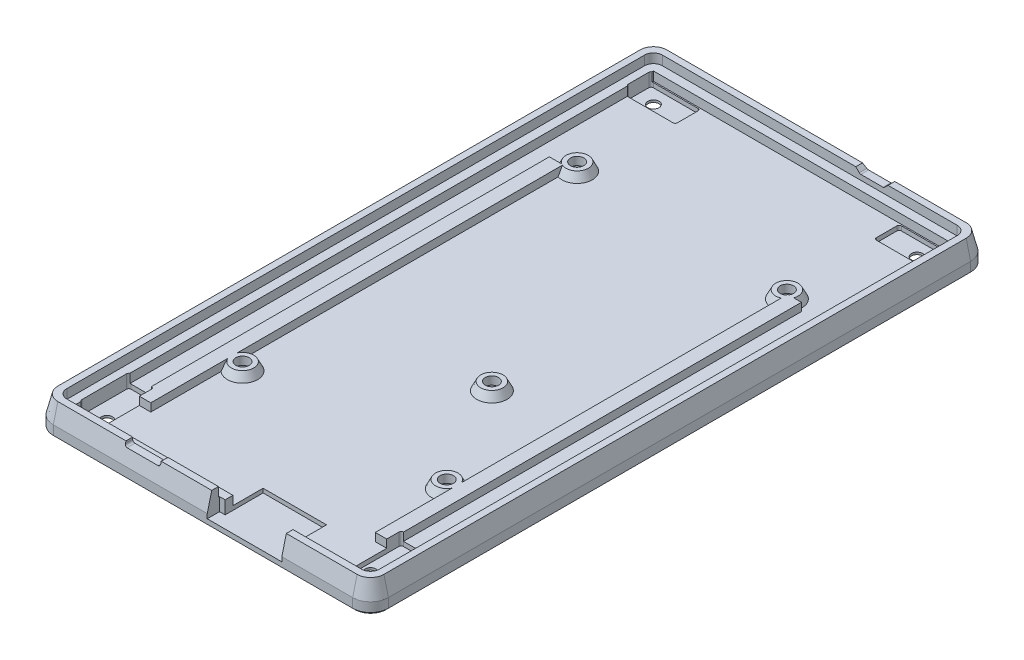
from build123d import *

# Parameters (mm, degrees)
SKETCH3_W                       = 66
SKETCH3_H                       = 129.34
EXTRUDE_THIN3_DEPTH             = 4.08
BOSS_EXTRUDE2_START             = -2.5
BOSS_EXTRUDE2_DEPTH             = 2.5
CUT_EXTRUDE1_DEPTH              = 2.08
SKETCH10_5_R                    = 1.5
SKETCH10_5_R_2                  = 4
BOSS_EXTRUDE3_DEPTH             = 1.8
SKETCH23_W                      = 16.7
SKETCH23_H                      = 2.5
SKETCH23_H_2                    = 0.35
CUT_EXTRUDE3_DEPTH              = 5
CUT_EXTRUDE18_START             = -2.5
CUT_EXTRUDE18_DEPTH             = 2.5
CUT_EXTRUDE20_REACH             = 142.993
CUT_EXTRUDE20_DIRECTION_2_REACH = 142.993
SKETCH26_R                      = 3.5
SKETCH26_R_2                    = 1.25
CUT_EXTRUDE6_DEPTH              = 1
CUT_EXTRUDE7_DEPTH              = 2.5
SKETCH10_7_W                    = 3.08
SKETCH10_7_H                    = 92.3
BOSS_EXTRUDE5_DEPTH             = 1.8
CUT_EXTRUDE9_START              = -3
CUT_EXTRUDE9_DEPTH              = 5.08
CUT_EXTRUDE19_DEPTH             = 79.955907315
CUT_EXTRUDE19_DEPTH_BACK        = 79.955907315
SKETCH26_3_R                    = 1.25
CHAMFER4_SIZE                   = 0.5
CHAMFER5_SIZE                   = 1
CHAMFER5_SIZE_2                 = 4


with BuildPart() as part:
    # Sketch3 → Extrude-Thin3 (new body)
    with BuildSketch(Plane(origin=(0, -2, 0), x_dir=(1, 0, 0), z_dir=(0, 1, 0))):
        with BuildLine():
            Line((33.5, 69.17), (-33.5, 69.17))
            ThreePointArc((-33.5, 69.17), (-36.328427125, 67.998427125), (-37.5, 65.17))
            Line((-37.5, 65.17), (-37.5, -65.17))
            ThreePointArc((-37.5, -65.17), (-36.328427125, -67.998427125), (-33.5, -69.17))
            Line((-33.5, -69.17), (33.5, -69.17))
            ThreePointArc((33.5, -69.17), (36.328427125, -67.998427125), (37.5, -65.17))
            Line((37.5, -65.17), (37.5, 65.17))
            ThreePointArc((37.5, 65.17), (36.328427125, 67.998427125), (33.5, 69.17))
        make_face()
        Rectangle(SKETCH3_W, SKETCH3_H, mode=Mode.SUBTRACT)
    extrude(amount=EXTRUDE_THIN3_DEPTH)

    # Sketch10 → Boss-Extrude2 (add)
    with BuildSketch(Plane(origin=(0, -2, 0), x_dir=(1, 0, 0), z_dir=(0, 1, 0)).offset(BOSS_EXTRUDE2_START)):
        with BuildLine():
            ThreePointArc((-37.5, -65.17), (-36.328427125, -67.998427125), (-33.5, -69.17))
            Line((-33.5, -69.17), (33.5, -69.17))
            ThreePointArc((33.5, -69.17), (36.328427125, -67.998427125), (37.5, -65.17))
            Line((37.5, -65.17), (37.5, 65.17))
            ThreePointArc((37.5, 65.17), (36.328427125, 67.998427125), (33.5, 69.17))
            Line((33.5, 69.17), (-33.5, 69.17))
            ThreePointArc((-33.5, 69.17), (-36.328427125, 67.998427125), (-37.5, 65.17))
            Line((-37.5, 65.17), (-37.5, -65.17))
        make_face()
    extrude(amount=BOSS_EXTRUDE2_DEPTH)

    # Sketch1 → Cut-Extrude1 (cut)
    with BuildSketch(Plane(origin=(0, 0, 0), x_dir=(1, 0, 0), z_dir=(0, 1, 0))):
        with BuildLine():
            Line((-33, 66.67), (33, 66.67))
            ThreePointArc((33, 66.67), (34.414213562, 66.084213562), (35, 64.67))
            Line((35, 64.67), (35, -64.67))
            ThreePointArc((35, -64.67), (34.414213562, -66.084213562), (33, -66.67))
            Line((33, -66.67), (-33, -66.67))
            ThreePointArc((-33, -66.67), (-34.414213562, -66.084213562), (-35, -64.67))
            Line((-35, -64.67), (-35, 64.67))
            ThreePointArc((-35, 64.67), (-34.414213562, 66.084213562), (-33, 66.67))
        make_face()
        with BuildLine():
            Line((-32.77, 64.39), (-22.77, 64.39))
            ThreePointArc((-22.77, 64.39), (-22.416446609, 64.243553391), (-22.27, 63.89))
            Line((-22.27, 63.89), (-22.27, 59.31))
            ThreePointArc((-22.27, 59.31), (-22.416446609, 58.956446609), (-22.77, 58.81))
            Line((-22.77, 58.81), (-32.77, 58.81))
            ThreePointArc((-32.77, 58.81), (-33.123553391, 58.956446609), (-33.27, 59.31))
            Line((-33.27, 59.31), (-33.27, 63.89))
            ThreePointArc((-33.27, 63.89), (-33.123553391, 64.243553391), (-32.77, 64.39))
        make_face(mode=Mode.SUBTRACT)
        with BuildLine():
            Line((-32.77, -52.51), (-28.19, -52.51))
            ThreePointArc((-28.19, -52.51), (-27.836446609, -52.656446609), (-27.69, -53.01))
            Line((-27.69, -53.01), (-27.69, -63.01))
            ThreePointArc((-27.69, -63.01), (-27.836446609, -63.363553391), (-28.19, -63.51))
            Line((-28.19, -63.51), (-32.77, -63.51))
            ThreePointArc((-32.77, -63.51), (-33.123553391, -63.363553391), (-33.27, -63.01))
            Line((-33.27, -63.01), (-33.27, -53.01))
            ThreePointArc((-33.27, -53.01), (-33.123553391, -52.656446609), (-32.77, -52.51))
        make_face(mode=Mode.SUBTRACT)
        with BuildLine():
            Line((33.27, -53.01), (33.27, -63.01))
            ThreePointArc((33.27, -63.01), (33.123553391, -63.363553391), (32.77, -63.51))
            Line((32.77, -63.51), (28.19, -63.51))
            ThreePointArc((28.19, -63.51), (27.836446609, -63.363553391), (27.69, -63.01))
            Line((27.69, -63.01), (27.69, -53.01))
            ThreePointArc((27.69, -53.01), (27.836446609, -52.656446609), (28.19, -52.51))
            Line((28.19, -52.51), (32.77, -52.51))
            ThreePointArc((32.77, -52.51), (33.123553391, -52.656446609), (33.27, -53.01))
        make_face(mode=Mode.SUBTRACT)
        with BuildLine():
            Line((32.77, 58.81), (22.77, 58.81))
            ThreePointArc((22.77, 58.81), (22.416446609, 58.956446609), (22.27, 59.31))
            Line((22.27, 59.31), (22.27, 63.89))
            ThreePointArc((22.27, 63.89), (22.416446609, 64.243553391), (22.77, 64.39))
            Line((22.77, 64.39), (32.77, 64.39))
            ThreePointArc((32.77, 64.39), (33.123553391, 64.243553391), (33.27, 63.89))
            Line((33.27, 63.89), (33.27, 59.31))
            ThreePointArc((33.27, 59.31), (33.123553391, 58.956446609), (32.77, 58.81))
        make_face(mode=Mode.SUBTRACT)
    extrude(amount=CUT_EXTRUDE1_DEPTH, mode=Mode.SUBTRACT)

    # Sketch10<5> → Boss-Extrude3 (add)
    # profile 1 of 5: a face of its own
    with BuildSketch(Plane(origin=(0, -2, 0), x_dir=(1, 0, 0), z_dir=(0, 1, 0))):
        with BuildLine():
            ThreePointArc((-25.13, 34.837016654), (-21.775087701, 41.943324615), (-27.509408232, 36.57))
            Line((-27.509408232, 36.57), (-25.13, 36.57))
            Line((-25.13, 36.57), (-25.13, 34.837016654))
        make_face()
        with Locations(Location((-24.13, 38.71, 0), (0, 0, 90))):
            Circle(SKETCH10_5_R, mode=Mode.SUBTRACT)
    # profile 2 of 5: a face of its own
    with BuildSketch(Plane(origin=(0, -2, 0), x_dir=(1, 0, 0), z_dir=(0, 1, 0))):
        with BuildLine():
            ThreePointArc((-25.13, -40.753493586), (-18.86, -37.46), (-25.13, -34.166506414))
            Line((-25.13, -34.166506414), (-25.13, -40.753493586))
        make_face()
        with Locations(Location((-22.86, -37.46, 0), (0, 0, 90))):
            Circle(SKETCH10_5_R, mode=Mode.SUBTRACT)
    # profile 3 of 5: a face of its own
    with BuildSketch(Plane(origin=(0, -2, 0), x_dir=(1, 0, 0), z_dir=(0, 1, 0))):
        with Locations(Location((24.13, 37.41, 0), (0, 0, 90))):
            Circle(SKETCH10_5_R_2)
        with Locations(Location((24.13, 37.41, 0), (0, 0, 90))):
            Circle(SKETCH10_5_R, mode=Mode.SUBTRACT)
    # profile 4 of 5: a face of its own
    with BuildSketch(Plane(origin=(0, -2, 0), x_dir=(1, 0, 0), z_dir=(0, 1, 0))):
        with Locations(Location((8.89, -13.39, 0), (0, 0, 90))):
            Circle(SKETCH10_5_R_2)
        with Locations(Location((8.89, -13.39, 0), (0, 0, 90))):
            Circle(SKETCH10_5_R, mode=Mode.SUBTRACT)
    # profile 5 of 5: a face of its own
    with BuildSketch(Plane(origin=(0, -2, 0), x_dir=(1, 0, 0), z_dir=(0, 1, 0))):
        with Locations(Location((22.86, -37.46, 0), (0, 0, 90))):
            Circle(SKETCH10_5_R_2)
        with Locations(Location((22.86, -37.46, 0), (0, 0, 90))):
            Circle(SKETCH10_5_R, mode=Mode.SUBTRACT)
    extrude(amount=BOSS_EXTRUDE3_DEPTH)

    # Chamfer3: read off the stored shape, not the designer's step
    # Chamfer3 outline → Chamfer3 (revolve, cut)
    with BuildSketch(Plane(origin=(8.89, 0, 13.39), x_dir=(1, 0, 0), z_dir=(0, 0, 1))):
        Polygon((2.5, -0.2), (3.4, -2), (4, -2), (4, -0.2), align=None)
    revolve(axis=Axis((8.89, 0, 13.39), (0, 1, 0)), mode=Mode.SUBTRACT)

    # Chamfer3 2 outline → Chamfer3 2 (revolve, cut)
    with BuildSketch(Plane(origin=(22.86, 0, 37.46), x_dir=(1, 0, 0), z_dir=(0, 0, 1))):
        Polygon((2.5, -0.2), (3.4, -2), (4, -2), (4, -0.2), align=None)
    revolve(axis=Axis((22.86, 0, 37.46), (0, 1, 0)), mode=Mode.SUBTRACT)

    # Chamfer3 3 outline → Chamfer3 3 (revolve, cut)
    with BuildSketch(Plane(origin=(-22.86, 0, 37.46), x_dir=(1, 0, 0), z_dir=(0, 0, 1))):
        Polygon((2.5, -0.2), (3.4, -2), (4, -2), (4, -0.2), align=None)
    revolve(axis=Axis((-22.86, 0, 37.46), (0, 1, 0)), mode=Mode.SUBTRACT)

    # Chamfer3 4 outline → Chamfer3 4 (revolve, cut)
    with BuildSketch(Plane(origin=(24.13, 0, -37.41), x_dir=(1, 0, 0), z_dir=(0, 0, 1))):
        Polygon((2.5, -0.2), (3.4, -2), (4, -2), (4, -0.2), align=None)
    revolve(axis=Axis((24.13, 0, -37.41), (0, 1, 0)), mode=Mode.SUBTRACT)

    # Chamfer3 5 outline → Chamfer3 5 (revolve, cut)
    with BuildSketch(Plane(origin=(-24.13, 0, -38.71), x_dir=(1, 0, 0), z_dir=(0, 0, 1))):
        Polygon((2.5, -0.2), (3.4, -2), (4, -2), (4, -0.2), align=None)
    revolve(axis=Axis((-24.13, 0, -38.71), (0, 1, 0)), mode=Mode.SUBTRACT)

    # Sketch23 → Cut-Extrude3 (cut)
    with BuildSketch(Plane(origin=(0, 2.08, 0), x_dir=(1, 0, 0), z_dir=(0, 1, 0))):
        Polygon((2.2, -66.42), (0.95, -66.42), (0.95, -66.67), (17.65, -66.67), (17.65, -66.42), (16.4, -66.42), (16.4, -57.92), (2.2, -57.92), align=None)
        with Locations((9.3, -67.92)):
            Rectangle(SKETCH23_W, SKETCH23_H)
        with Locations((9.3, -69.345)):
            Rectangle(SKETCH23_W, SKETCH23_H_2)
    extrude(amount=-CUT_EXTRUDE3_DEPTH, mode=Mode.SUBTRACT)

    # Cut-Extrude18: read off the stored shape, not the designer's step
    # Cut-Extrude18 outline → Cut-Extrude18 (cut)
    with BuildSketch(Plane(origin=(0, 0, 66.67), x_dir=(-1, 0, 0), z_dir=(0, 0, -1)).offset(CUT_EXTRUDE18_START)):
        with BuildLine():
            Line((10.35, 2.08), (10.35, 1.620192379))
            ThreePointArc((10.35, 1.620192379), (10.496446609, 1.266638988), (10.85, 1.120192379))
            Line((10.85, 1.120192379), (17.75, 1.120192379))
            ThreePointArc((17.75, 1.120192379), (18.103553391, 1.266638988), (18.25, 1.620192379))
            Line((18.25, 1.620192379), (18.25, 2.08))
            Line((18.25, 2.08), (10.35, 2.08))
        make_face()
    extrude(amount=CUT_EXTRUDE18_DEPTH, mode=Mode.SUBTRACT)

    # Cut-Extrude20: up to this face of the body (flat: up to its plane)
    cut_extrude20_end = Plane(part.part.faces().sort_by_distance((0, -1.21, -69.17))[0])
    # Sketch35 → Cut-Extrude20 (cut, up to the picked face)
    with BuildSketch(Plane.XY.offset(-66.67), mode=Mode.PRIVATE) as cut_extrude20_sk1:
        with BuildLine():
            Line((10.292893219, 2.08), (11.071446609, 1.301446609))
            ThreePointArc((11.071446609, 1.301446609), (11.233658284, 1.193060234), (11.425, 1.155))
            Line((11.425, 1.155), (16.375, 1.155))
            ThreePointArc((16.375, 1.155), (16.566341716, 1.193060234), (16.728553391, 1.301446609))
            Line((16.728553391, 1.301446609), (17.507106781, 2.08))
            Line((17.507106781, 2.08), (10.292893219, 2.08))
        make_face()
    cut_extrude20_tool1 = split(extrude(cut_extrude20_sk1.sketch, amount=-CUT_EXTRUDE20_REACH, mode=Mode.PRIVATE), bisect_by=cut_extrude20_end, keep=Keep.BOTH, mode=Mode.PRIVATE)
    add(cut_extrude20_tool1.solids().sort_by(Axis((13.9, 1.641017, -66.67), (0, 0, -1)))[0], mode=Mode.SUBTRACT)

    # Cut-Extrude20 direction 2: up to this face of the body (flat: up to its plane)
    cut_extrude20_direction_2_end = Plane(part.part.faces().sort_by_distance((0, -1, -64.67))[0])
    # Sketch35 → Cut-Extrude20 direction 2 (cut, up to the picked face)
    with BuildSketch(Plane.XY.offset(-66.67), mode=Mode.PRIVATE) as cut_extrude20_direction_2_sk1:
        with BuildLine():
            Line((10.292893219, 2.08), (11.071446609, 1.301446609))
            ThreePointArc((11.071446609, 1.301446609), (11.233658284, 1.193060234), (11.425, 1.155))
            Line((11.425, 1.155), (16.375, 1.155))
            ThreePointArc((16.375, 1.155), (16.566341716, 1.193060234), (16.728553391, 1.301446609))
            Line((16.728553391, 1.301446609), (17.507106781, 2.08))
            Line((17.507106781, 2.08), (10.292893219, 2.08))
        make_face()
    cut_extrude20_direction_2_tool1 = split(extrude(cut_extrude20_direction_2_sk1.sketch, amount=CUT_EXTRUDE20_DIRECTION_2_REACH, mode=Mode.PRIVATE), bisect_by=cut_extrude20_direction_2_end, keep=Keep.BOTH, mode=Mode.PRIVATE)
    add(cut_extrude20_direction_2_tool1.solids().sort_by(Axis((13.9, 1.641017, -66.67), (0, 0, 1)))[0], mode=Mode.SUBTRACT)

    # Sketch26 → Cut-Extrude6 (cut)
    # profile 1 of 4: a face of its own
    with BuildSketch(Plane.XZ.offset(4.5)):
        with Locations(Location((-29.5, 61.17, 0), (0, 0, 270))):
            Circle(SKETCH26_R)
        with Locations(Location((-29.5, 61.17, 0), (0, 0, 270))):
            Circle(SKETCH26_R_2, mode=Mode.SUBTRACT)
    # profile 2 of 4: a face of its own
    with BuildSketch(Plane.XZ.offset(4.5)):
        with Locations(Location((29.5, 61.17, 0), (0, 0, 270))):
            Circle(SKETCH26_R)
        with Locations(Location((29.5, 61.17, 0), (0, 0, 270))):
            Circle(SKETCH26_R_2, mode=Mode.SUBTRACT)
    # profile 3 of 4: a face of its own
    with BuildSketch(Plane.XZ.offset(4.5)):
        with Locations(Location((29.5, -61.17, 0), (0, 0, 270))):
            Circle(SKETCH26_R)
        with Locations(Location((29.5, -61.17, 0), (0, 0, 270))):
            Circle(SKETCH26_R_2, mode=Mode.SUBTRACT)
    # profile 4 of 4: a face of its own
    with BuildSketch(Plane.XZ.offset(4.5)):
        with Locations(Location((-29.5, -61.17, 0), (0, 0, 270))):
            Circle(SKETCH26_R)
        with Locations(Location((-29.5, -61.17, 0), (0, 0, 270))):
            Circle(SKETCH26_R_2, mode=Mode.SUBTRACT)
    extrude(amount=-CUT_EXTRUDE6_DEPTH, mode=Mode.SUBTRACT)

    # Sketch31 → Cut-Extrude7 (cut)
    with BuildSketch(Plane.XZ.offset(4.5)):
        Polygon((-20.31, 35.987756814), (-20.31, 38.932243186), (-22.86, 40.404486373), (-25.41, 38.932243186), (-25.41, 35.987756814), (-22.86, 34.515513627), align=None)
        Polygon((25.41, 35.987756814), (25.41, 38.932243186), (22.86, 40.404486373), (20.31, 38.932243186), (20.31, 35.987756814), (22.86, 34.515513627), align=None)
        Polygon((11.44, 11.917756814), (11.44, 14.862243186), (8.89, 16.334486373), (6.34, 14.862243186), (6.34, 11.917756814), (8.89, 10.445513627), align=None)
        Polygon((26.68, -38.882243186), (26.68, -35.937756814), (24.13, -34.465513627), (21.58, -35.937756814), (21.58, -38.882243186), (24.13, -40.354486373), align=None)
        Polygon((-21.58, -40.182243186), (-21.58, -37.237756814), (-24.13, -35.765513627), (-26.68, -37.237756814), (-26.68, -40.182243186), (-24.13, -41.654486373), align=None)
    extrude(amount=-CUT_EXTRUDE7_DEPTH, mode=Mode.SUBTRACT)

    # Sketch10<7> → Boss-Extrude5 (add)
    with BuildSketch(Plane(origin=(0, -2, 0), x_dir=(1, 0, 0), z_dir=(0, 1, 0))):
        with Locations((-26.67, -9.58)):
            Rectangle(SKETCH10_7_W, SKETCH10_7_H)
    boss_extrude5 = extrude(amount=BOSS_EXTRUDE5_DEPTH)

    # Mirror1: Boss-Extrude5 across plane
    add(boss_extrude5.mirror(Plane(origin=(0, 0, 0), x_dir=(0, 0, 1), z_dir=(1, 0, 0))))

    # Sketch1<14> → Cut-Extrude9 (cut)
    with BuildSketch(Plane(origin=(0, 0, 0), x_dir=(1, 0, 0), z_dir=(0, 1, 0)).offset(CUT_EXTRUDE9_START)):
        with BuildLine():
            Line((-32.77, 64.39), (-22.77, 64.39))
            ThreePointArc((-22.77, 64.39), (-22.416446609, 64.243553391), (-22.27, 63.89))
            Line((-22.27, 63.89), (-22.27, 59.31))
            ThreePointArc((-22.27, 59.31), (-22.416446609, 58.956446609), (-22.77, 58.81))
            Line((-22.77, 58.81), (-32.77, 58.81))
            ThreePointArc((-32.77, 58.81), (-33.123553391, 58.956446609), (-33.27, 59.31))
            Line((-33.27, 59.31), (-33.27, 63.89))
            ThreePointArc((-33.27, 63.89), (-33.123553391, 64.243553391), (-32.77, 64.39))
        make_face()
        with BuildLine():
            Line((-32.77, -52.51), (-28.19, -52.51))
            ThreePointArc((-28.19, -52.51), (-27.836446609, -52.656446609), (-27.69, -53.01))
            Line((-27.69, -53.01), (-27.69, -63.01))
            ThreePointArc((-27.69, -63.01), (-27.836446609, -63.363553391), (-28.19, -63.51))
            Line((-28.19, -63.51), (-32.77, -63.51))
            ThreePointArc((-32.77, -63.51), (-33.123553391, -63.363553391), (-33.27, -63.01))
            Line((-33.27, -63.01), (-33.27, -53.01))
            ThreePointArc((-33.27, -53.01), (-33.123553391, -52.656446609), (-32.77, -52.51))
        make_face()
        with BuildLine():
            Line((33.27, -53.01), (33.27, -63.01))
            ThreePointArc((33.27, -63.01), (33.123553391, -63.363553391), (32.77, -63.51))
            Line((32.77, -63.51), (28.19, -63.51))
            ThreePointArc((28.19, -63.51), (27.836446609, -63.363553391), (27.69, -63.01))
            Line((27.69, -63.01), (27.69, -53.01))
            ThreePointArc((27.69, -53.01), (27.836446609, -52.656446609), (28.19, -52.51))
            Line((28.19, -52.51), (32.77, -52.51))
            ThreePointArc((32.77, -52.51), (33.123553391, -52.656446609), (33.27, -53.01))
        make_face()
        with BuildLine():
            Line((32.77, 58.81), (22.77, 58.81))
            ThreePointArc((22.77, 58.81), (22.416446609, 58.956446609), (22.27, 59.31))
            Line((22.27, 59.31), (22.27, 63.89))
            ThreePointArc((22.27, 63.89), (22.416446609, 64.243553391), (22.77, 64.39))
            Line((22.77, 64.39), (32.77, 64.39))
            ThreePointArc((32.77, 64.39), (33.123553391, 64.243553391), (33.27, 63.89))
            Line((33.27, 63.89), (33.27, 59.31))
            ThreePointArc((33.27, 59.31), (33.123553391, 58.956446609), (32.77, 58.81))
        make_face()
    extrude(amount=CUT_EXTRUDE9_DEPTH, mode=Mode.SUBTRACT)

    # Sketch26<3> → Cut-Extrude19 (cut, two sides: drawn at the far end of the back side and taken through both)
    with BuildSketch(Plane.XZ.offset(4.5).offset(-CUT_EXTRUDE19_DEPTH_BACK)):
        with Locations(Location((-29.5, 61.17, 0), (0, 0, 270))):
            Circle(SKETCH26_3_R)
        with Locations(Location((29.5, 61.17, 0), (0, 0, 270))):
            Circle(SKETCH26_3_R)
        with Locations(Location((-29.5, -61.17, 0), (0, 0, 270))):
            Circle(SKETCH26_3_R)
        with Locations(Location((29.5, -61.17, 0), (0, 0, 270))):
            Circle(SKETCH26_3_R)
    extrude(amount=CUT_EXTRUDE19_DEPTH + CUT_EXTRUDE19_DEPTH_BACK, mode=Mode.SUBTRACT)

    # Chamfer4
    chamfer4_edges = [part.edges().sort_by_distance(p)[0] for p in [
        (36.328427125, -4.5, 67.998427125),
        (0, -4.5, 69.17),
        (-36.328427125, -4.5, 67.998427125),
        (-37.5, -4.5, 0),
        (-36.328427125, -4.5, -67.998427125),
        (0, -4.5, -69.17),
        (36.328427125, -4.5, -67.998427125),
        (37.5, -4.5, 0),
    ]]
    chamfer(chamfer4_edges, length=CHAMFER4_SIZE)

    # Chamfer5
    # the kernel refuses this chamfer: 4, 1 mm, written as the material it takes off along each edge
    with BuildSketch(Plane(origin=(33.5, 2.08, -65.17), x_dir=(1, 0, 0), z_dir=(0, 0, 1))) as chamfer5_piece_1:
        Polygon((4 - CHAMFER5_SIZE, 0), (4, -CHAMFER5_SIZE_2), (4, 0), align=None)
    revolve(axis=Axis((33.5, 2.08, -65.17), (0, 1, 0)), revolution_arc=90, mode=Mode.SUBTRACT)
    with BuildSketch(Plane(origin=(37.5, 2.08, 65.17), x_dir=(0, -1, 0), z_dir=(0, 0, -1))) as chamfer5_piece_2:
        Polygon((CHAMFER5_SIZE_2, 0), (0, CHAMFER5_SIZE), (0, 0), align=None)
    extrude(amount=130.34, mode=Mode.SUBTRACT)
    with BuildSketch(Plane(origin=(7.261490001, 2.08, 69.17), x_dir=(0, 0, -1), z_dir=(1, 0, 0))) as chamfer5_piece_3:
        Polygon((CHAMFER5_SIZE, 0), (0, -CHAMFER5_SIZE_2), (0, 0), align=None)
    extrude(amount=26.238509999, mode=Mode.SUBTRACT)
    with BuildSketch(Plane(origin=(33.5, 2.08, 65.17), x_dir=(0, 0, 1), z_dir=(-1, 0, 0))) as chamfer5_piece_4:
        Polygon((4, -CHAMFER5_SIZE_2), (4 - CHAMFER5_SIZE, 0), (4, 0), align=None)
    revolve(axis=Axis((33.5, 2.08, 65.17), (0, 1, 0)), revolution_arc=90, mode=Mode.SUBTRACT)
    with BuildSketch(Plane(origin=(-20.738509999, 2.08, 69.17), x_dir=(0, -1, 0), z_dir=(1, 0, 0))) as chamfer5_piece_5:
        Polygon((CHAMFER5_SIZE_2, 0), (0, CHAMFER5_SIZE), (0, 0), align=None)
    extrude(amount=32.077019998, mode=Mode.SUBTRACT)
    with BuildSketch(Plane(origin=(20.681403218, 2.08, -69.17), x_dir=(0, -1, 0), z_dir=(-1, 0, 0))) as chamfer5_piece_6:
        Polygon((CHAMFER5_SIZE_2, 0), (0, CHAMFER5_SIZE), (0, 0), align=None)
    extrude(amount=54.181403218, mode=Mode.SUBTRACT)
    with BuildSketch(Plane(origin=(-33.5, 2.08, -65.17), x_dir=(0, 0, -1), z_dir=(1, 0, 0))) as chamfer5_piece_7:
        Polygon((4 - CHAMFER5_SIZE, 0), (4, -CHAMFER5_SIZE_2), (4, 0), align=None)
    revolve(axis=Axis((-33.5, 2.08, -65.17), (0, 1, 0)), revolution_arc=90, mode=Mode.SUBTRACT)
    with BuildSketch(Plane(origin=(-37.5, 2.08, -65.17), x_dir=(1, 0, 0), z_dir=(0, 0, 1))) as chamfer5_piece_8:
        Polygon((CHAMFER5_SIZE, 0), (0, -CHAMFER5_SIZE_2), (0, 0), align=None)
    extrude(amount=130.34, mode=Mode.SUBTRACT)
    with BuildSketch(Plane(origin=(-33.5, 2.08, 65.17), x_dir=(-1, 0, 0), z_dir=(0, 0, -1))) as chamfer5_piece_9:
        Polygon((4, -CHAMFER5_SIZE_2), (4 - CHAMFER5_SIZE, 0), (4, 0), align=None)
    revolve(axis=Axis((-33.5, 2.08, 65.17), (0, 1, 0)), revolution_arc=90, mode=Mode.SUBTRACT)
    with BuildSketch(Plane(origin=(-33.5, 2.08, 69.17), x_dir=(0, -1, 0), z_dir=(1, 0, 0))) as chamfer5_piece_10:
        Polygon((CHAMFER5_SIZE_2, 0), (0, CHAMFER5_SIZE), (0, 0), align=None)
    extrude(amount=25.638509999, mode=Mode.SUBTRACT)
    with BuildSketch(Plane(origin=(33.5, 2.08, -69.17), x_dir=(0, 0, 1), z_dir=(-1, 0, 0))) as chamfer5_piece_11:
        Polygon((CHAMFER5_SIZE, 0), (0, -CHAMFER5_SIZE_2), (0, 0), align=None)
    extrude(amount=26.381403218, mode=Mode.SUBTRACT)


solid = part.part
